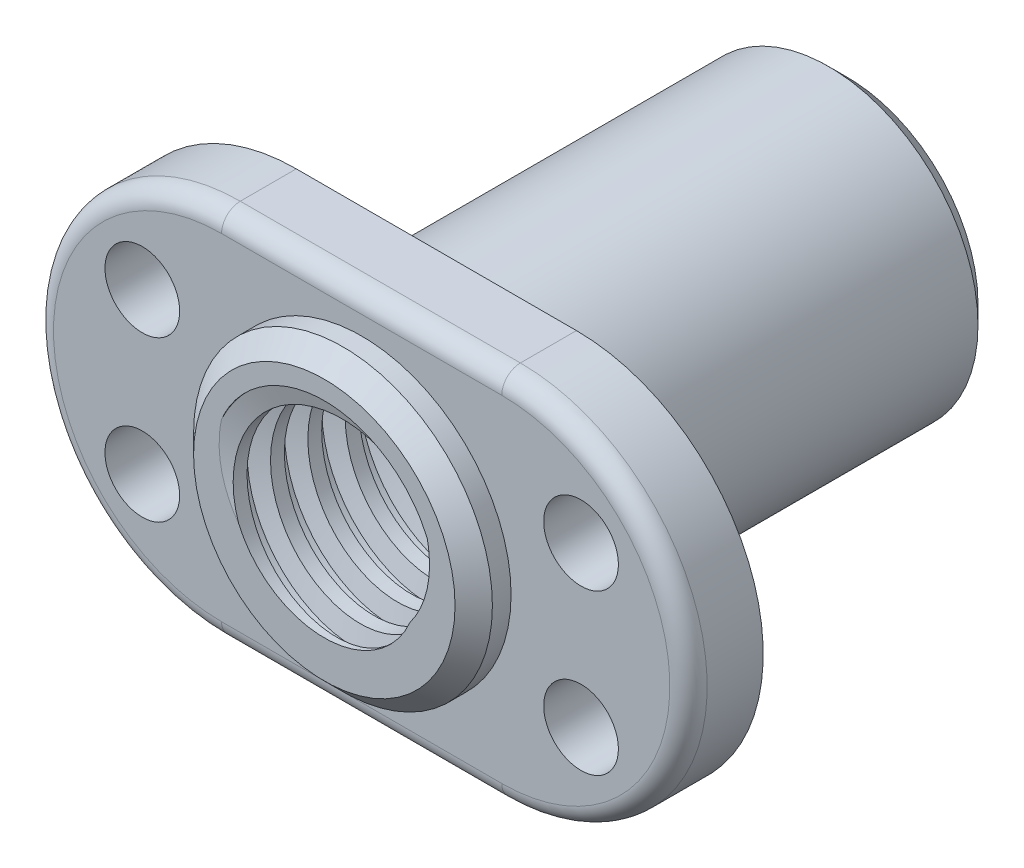
from build123d import *

# Parameters (mm, degrees)
CROQUIS1_R                   = 5
SALIENTE_EXTRUIR1_DEPTH      = 4
SALIENTE_EXTRUIR2_DEPTH      = 22
SALIENTE_EXTRUIR2_DEPTH_BACK = 6
CROQUIS2_R                   = 8
CROQUIS2_R_2                 = 5
REDONDEO1_R                  = 1
CHAFL_N1_SIZE                = 1
CHAFL_N2_SIZE                = 1
CORTAR_BARRER1_PITCH         = 2
CROQUIS5_R                   = 2
CORTAR_EXTRUIR1_DEPTH        = 4


with BuildPart() as part:
    # Croquis1 → Saliente-Extruir1 (new body)
    with BuildSketch(Plane.XY):
        with BuildLine():
            Line((-7.5, 10), (7.5, 10))
            ThreePointArc((7.5, 10), (17.5, 0), (7.5, -10))
            Line((7.5, -10), (-7.5, -10))
            ThreePointArc((-7.5, -10), (-17.5, 0), (-7.5, 10))
        make_face()
        Circle(CROQUIS1_R, mode=Mode.SUBTRACT)
    extrude(amount=SALIENTE_EXTRUIR1_DEPTH)

    # Croquis2 → Saliente-Extruir2 (add, two sides: drawn at the far end of the back side and taken through both)
    with BuildSketch(Plane(origin=(0, 0, 0), x_dir=(-1, 0, 0), z_dir=(0, 0, -1)).offset(-SALIENTE_EXTRUIR2_DEPTH_BACK)):
        Circle(CROQUIS2_R)
        Circle(CROQUIS2_R_2, mode=Mode.SUBTRACT)
    extrude(amount=SALIENTE_EXTRUIR2_DEPTH + SALIENTE_EXTRUIR2_DEPTH_BACK)

    # Redondeo1
    redondeo1_edges = [part.edges().sort_by_distance(p)[0] for p in [
        (17.5, 0, 4),
        (0, 10, 4),
        (8, 0, 0),
        (-17.5, 0, 4),
        (0, -10, 4),
    ]]
    fillet(redondeo1_edges, radius=REDONDEO1_R)

    # Chaflán1
    chafl_n1_edges = [part.edges().sort_by_distance(p)[0] for p in [
        (8, 0, -22),
    ]]
    chamfer(chafl_n1_edges, length=CHAFL_N1_SIZE)

    # Chaflán2
    chafl_n2_edges = [part.edges().sort_by_distance(p)[0] for p in [
        (8, 0, 6),
    ]]
    chamfer(chafl_n2_edges, length=CHAFL_N2_SIZE)

    # Cortar-Barrer1: arcs per turn and ends read off the stored shape
    # Cortar-Barrer1: the profile of Croquis4 profile screwed along a right-hand helix through 15.6 turns, 10 arcs to a turn; built about Z, then put on its axis
    cortar_barrer1_z = Axis((0, 0, 0), (0, 0, 1))
    cortar_barrer1_corners = [(4.9997, 0, -2.629386377), (4.9997, 0, -1.370613623), (6, 0, -1.629308792), (6, 0, -2.370691208)]
    with BuildLine(mode=Mode.PRIVATE) as cortar_barrer1_profile:
        Line(cortar_barrer1_corners[0], cortar_barrer1_corners[1])
        Line(cortar_barrer1_corners[1], cortar_barrer1_corners[2])
        Line(cortar_barrer1_corners[2], cortar_barrer1_corners[3])
        Line(cortar_barrer1_corners[3], cortar_barrer1_corners[0])
    cortar_barrer1_cap = Face(cortar_barrer1_profile.wire())
    cortar_barrer1_turn_angles = [0, 18, 36, 54, 72, 90, 108, 126, 144, 162, 180, 198, 216, 234, 252, 270, 288, 306, 324, 342, 360]
    cortar_barrer1_turn_weights = [1, 0.9510565162951535, 1, 0.9510565162951535, 1, 0.9510565162951535, 1, 0.9510565162951535, 1, 0.9510565162951535, 1, 0.9510565162951535, 1, 0.9510565162951535, 1, 0.9510565162951535, 1, 0.9510565162951535, 1, 0.9510565162951535, 1]
    cortar_barrer1_turn_rails = [Edge.make_bspline([Vector(p[0], p[1], 0).rotate(cortar_barrer1_z, cortar_barrer1_turn_angles[k]) / cortar_barrer1_turn_weights[k] + Vector(0, 0, p[2] + CORTAR_BARRER1_PITCH * cortar_barrer1_turn_angles[k] / 360) for k in range(21)], [0, 0, 0, 1, 1, 2, 2, 3, 3, 4, 4, 5, 5, 6, 6, 7, 7, 8, 8, 9, 9, 10, 10, 10], 2, cortar_barrer1_turn_weights) for p in cortar_barrer1_corners]
    cortar_barrer1_turn_sides = [Face.make_surface_from_curves(cortar_barrer1_turn_rails[p[0]], cortar_barrer1_turn_rails[p[1]]) for p in [(0, 1), (1, 2), (2, 3), (3, 0)]]
    cortar_barrer1_last_angles = [5400, 5418, 5436, 5454, 5472, 5490, 5508, 5526, 5544, 5562, 5580, 5598, 5616]
    cortar_barrer1_last_weights = [1, 0.9510565162951535, 1, 0.9510565162951535, 1, 0.9510565162951535, 1, 0.9510565162951535, 1, 0.9510565162951535, 1, 0.9510565162951535, 1]
    cortar_barrer1_last_rails = [Edge.make_bspline([Vector(p[0], p[1], 0).rotate(cortar_barrer1_z, cortar_barrer1_last_angles[k]) / cortar_barrer1_last_weights[k] + Vector(0, 0, p[2] + CORTAR_BARRER1_PITCH * cortar_barrer1_last_angles[k] / 360) for k in range(13)], [0, 0, 0, 1, 1, 2, 2, 3, 3, 4, 4, 5, 5, 6, 6, 6], 2, cortar_barrer1_last_weights) for p in cortar_barrer1_corners]
    cortar_barrer1_last_sides = [Face.make_surface_from_curves(cortar_barrer1_last_rails[p[0]], cortar_barrer1_last_rails[p[1]]) for p in [(0, 1), (1, 2), (2, 3), (3, 0)]]
    cortar_barrer1 = Plane(origin=(0, 0, 6), x_dir=(0, 1, 0), z_dir=(0, 0, -1)) * Solid(Shell([*[p.moved(Location((0, 0, CORTAR_BARRER1_PITCH * i))) for i in range(15) for p in cortar_barrer1_turn_sides], *cortar_barrer1_last_sides, cortar_barrer1_cap, cortar_barrer1_cap.rotate(cortar_barrer1_z, 5616).moved(Location((0, 0, CORTAR_BARRER1_PITCH * 5616 / 360)))]))
    add(cortar_barrer1, mode=Mode.SUBTRACT)

    # Croquis5 → Cortar-Extruir1 (cut)
    with BuildSketch(Plane.XY.offset(4)):
        with Locations((-11.74615776, 4.275251792)):
            Circle(CROQUIS5_R)
        with Locations((-11.74615776, -4.275251792)):
            Circle(CROQUIS5_R)
        with Locations((11.74615776, -4.275251792)):
            Circle(CROQUIS5_R)
        with Locations((11.74615776, 4.275251792)):
            Circle(CROQUIS5_R)
    extrude(amount=-CORTAR_EXTRUIR1_DEPTH, mode=Mode.SUBTRACT)


solid = part.part
